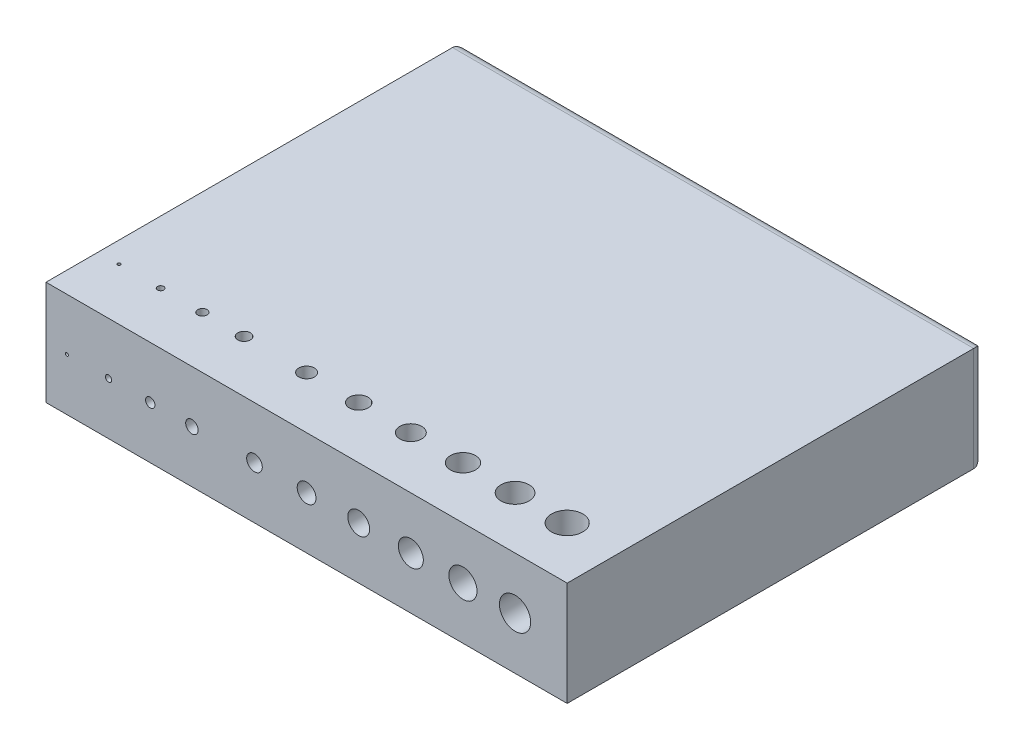
from build123d import *

# Parameters (mm, degrees)
SKETCH1_W                 = 50
SKETCH1_H                 = 40
BOSS_EXTRUDE1_DEPTH       = 10
CUT_EXTRUDE1_START        = -40
CUT_EXTRUDE1_OUTLINE_R    = 0.3
CUT_EXTRUDE1_OUTLINE_R_2  = 0.45
CUT_EXTRUDE1_OUTLINE_R_3  = 0.6
CUT_EXTRUDE1_OUTLINE_R_4  = 0.75
CUT_EXTRUDE1_OUTLINE_R_5  = 0.9
CUT_EXTRUDE1_OUTLINE_R_6  = 1.05
CUT_EXTRUDE1_OUTLINE_R_7  = 1.35
CUT_EXTRUDE1_OUTLINE_R_8  = 1.5
CUT_EXTRUDE1_OUTLINE_R_9  = 1.2
CUT_EXTRUDE1_OUTLINE_R_10 = 0.15
CUT_EXTRUDE1_DEPTH        = 40
FILLET1_R                 = 1


# Read off the part's stored shape, not the designer's step: Cut-Extrude1
with BuildPart() as part:
    # Sketch1 → Boss-Extrude1 (new body)
    with BuildSketch(Plane(origin=(0, 0, 0), x_dir=(1, 0, 0), z_dir=(0, 1, 0))):
        with Locations((0, 20)):
            Rectangle(SKETCH1_W, SKETCH1_H)
    extrude(amount=BOSS_EXTRUDE1_DEPTH)

    # Cut-Extrude1 outline → Cut-Extrude1 (cut)
    with BuildSketch(Plane.XY.offset(CUT_EXTRUDE1_START)):
        with Locations((-19, 5)):
            Circle(CUT_EXTRUDE1_OUTLINE_R)
        with Locations((-15, 5)):
            Circle(CUT_EXTRUDE1_OUTLINE_R_2)
        with Locations((-11, 5)):
            Circle(CUT_EXTRUDE1_OUTLINE_R_3)
        with Locations((-5, 5)):
            Circle(CUT_EXTRUDE1_OUTLINE_R_4)
        with Locations((0, 5)):
            Circle(CUT_EXTRUDE1_OUTLINE_R_5)
        with Locations((5, 5)):
            Circle(CUT_EXTRUDE1_OUTLINE_R_6)
        with Locations((15, 5)):
            Circle(CUT_EXTRUDE1_OUTLINE_R_7)
        with Locations((20, 5)):
            Circle(CUT_EXTRUDE1_OUTLINE_R_8)
        with Locations((10, 5)):
            Circle(CUT_EXTRUDE1_OUTLINE_R_9)
        with Locations((-23, 5)):
            Circle(CUT_EXTRUDE1_OUTLINE_R_10)
    cut_extrude1 = extrude(amount=CUT_EXTRUDE1_DEPTH, mode=Mode.SUBTRACT)

    # Mirror1: Cut-Extrude1 across plane
    add(cut_extrude1.mirror(Plane(origin=(0, 0, 0), x_dir=(0, -0.7071067811865478, 0.7071067811865472), z_dir=(0, 0.7071067811865475, 0.7071067811865477))), mode=Mode.SUBTRACT)

    # Fillet1
    # the kernel refuses this fillet: 1 mm, written as the material it takes off along each edge
    with BuildSketch(Plane(origin=(-27.5, 10, -40), x_dir=(0, -1, 0), z_dir=(1, 0, 0))) as fillet1_piece_1:
        with BuildLine():
            CenterArc((FILLET1_R, -FILLET1_R), FILLET1_R, 90, 90)
            Line((0, -FILLET1_R), (0, 0))
            Line((0, 0), (FILLET1_R, 0))
        make_face()
    extrude(amount=55, mode=Mode.SUBTRACT)
    with BuildSketch(Plane(origin=(-23, 5, -40), x_dir=(1, 0, 0), z_dir=(0, -1, 0))) as fillet1_piece_2:
        with BuildLine():
            CenterArc((0.15 + FILLET1_R, FILLET1_R), FILLET1_R, 180, 90)
            Line((0.15, FILLET1_R), (0.15, 0))
            Line((0.15, 0), (0.15 + FILLET1_R, 0))
        make_face()
    revolve(axis=Axis((-23, 5, -40), (0, 0, 1)), mode=Mode.SUBTRACT)
    with BuildSketch(Plane(origin=(10, 5, -40), x_dir=(1, 0, 0), z_dir=(0, -1, 0))) as fillet1_piece_3:
        with BuildLine():
            CenterArc((1.2 + FILLET1_R, FILLET1_R), FILLET1_R, 180, 90)
            Line((1.2, FILLET1_R), (1.2, 0))
            Line((1.2, 0), (1.2 + FILLET1_R, 0))
        make_face()
    revolve(axis=Axis((10, 5, -40), (0, 0, 1)), mode=Mode.SUBTRACT)
    with BuildSketch(Plane(origin=(20, 5, -40), x_dir=(1, 0, 0), z_dir=(0, -1, 0))) as fillet1_piece_4:
        with BuildLine():
            CenterArc((1.5 + FILLET1_R, FILLET1_R), FILLET1_R, 180, 90)
            Line((1.5, FILLET1_R), (1.5, 0))
            Line((1.5, 0), (1.5 + FILLET1_R, 0))
        make_face()
    revolve(axis=Axis((20, 5, -40), (0, 0, 1)), mode=Mode.SUBTRACT)
    with BuildSketch(Plane(origin=(15, 5, -40), x_dir=(1, 0, 0), z_dir=(0, -1, 0))) as fillet1_piece_5:
        with BuildLine():
            CenterArc((1.35 + FILLET1_R, FILLET1_R), FILLET1_R, 180, 90)
            Line((1.35, FILLET1_R), (1.35, 0))
            Line((1.35, 0), (1.35 + FILLET1_R, 0))
        make_face()
    revolve(axis=Axis((15, 5, -40), (0, 0, 1)), mode=Mode.SUBTRACT)
    with BuildSketch(Plane(origin=(5, 5, -40), x_dir=(1, 0, 0), z_dir=(0, -1, 0))) as fillet1_piece_6:
        with BuildLine():
            CenterArc((1.05 + FILLET1_R, FILLET1_R), FILLET1_R, 180, 90)
            Line((1.05, FILLET1_R), (1.05, 0))
            Line((1.05, 0), (1.05 + FILLET1_R, 0))
        make_face()
    revolve(axis=Axis((5, 5, -40), (0, 0, 1)), mode=Mode.SUBTRACT)
    with BuildSketch(Plane(origin=(0, 5, -40), x_dir=(1, 0, 0), z_dir=(0, -1, 0))) as fillet1_piece_7:
        with BuildLine():
            CenterArc((0.9 + FILLET1_R, FILLET1_R), FILLET1_R, 180, 90)
            Line((0.9, FILLET1_R), (0.9, 0))
            Line((0.9, 0), (0.9 + FILLET1_R, 0))
        make_face()
    revolve(axis=Axis((0, 5, -40), (0, 0, 1)), mode=Mode.SUBTRACT)
    with BuildSketch(Plane(origin=(-5, 5, -40), x_dir=(1, 0, 0), z_dir=(0, -1, 0))) as fillet1_piece_8:
        with BuildLine():
            CenterArc((0.75 + FILLET1_R, FILLET1_R), FILLET1_R, 180, 90)
            Line((0.75, FILLET1_R), (0.75, 0))
            Line((0.75, 0), (0.75 + FILLET1_R, 0))
        make_face()
    revolve(axis=Axis((-5, 5, -40), (0, 0, 1)), mode=Mode.SUBTRACT)
    with BuildSketch(Plane(origin=(-11, 5, -40), x_dir=(1, 0, 0), z_dir=(0, -1, 0))) as fillet1_piece_9:
        with BuildLine():
            CenterArc((0.6 + FILLET1_R, FILLET1_R), FILLET1_R, 180, 90)
            Line((0.6, FILLET1_R), (0.6, 0))
            Line((0.6, 0), (0.6 + FILLET1_R, 0))
        make_face()
    revolve(axis=Axis((-11, 5, -40), (0, 0, 1)), mode=Mode.SUBTRACT)
    with BuildSketch(Plane(origin=(-15, 5, -40), x_dir=(1, 0, 0), z_dir=(0, -1, 0))) as fillet1_piece_10:
        with BuildLine():
            CenterArc((0.45 + FILLET1_R, FILLET1_R), FILLET1_R, 180, 90)
            Line((0.45, FILLET1_R), (0.45, 0))
            Line((0.45, 0), (0.45 + FILLET1_R, 0))
        make_face()
    revolve(axis=Axis((-15, 5, -40), (0, 0, 1)), mode=Mode.SUBTRACT)
    with BuildSketch(Plane(origin=(-19, 5, -40), x_dir=(1, 0, 0), z_dir=(0, -1, 0))) as fillet1_piece_11:
        with BuildLine():
            CenterArc((0.3 + FILLET1_R, FILLET1_R), FILLET1_R, 180, 90)
            Line((0.3, FILLET1_R), (0.3, 0))
            Line((0.3, 0), (0.3 + FILLET1_R, 0))
        make_face()
    revolve(axis=Axis((-19, 5, -40), (0, 0, 1)), mode=Mode.SUBTRACT)
    with BuildSketch(Plane(origin=(-27.5, 0, -40), x_dir=(0, 1, 0), z_dir=(1, 0, 0))) as fillet1_piece_12:
        with BuildLine():
            CenterArc((FILLET1_R, FILLET1_R), FILLET1_R, 180, 90)
            Line((0, FILLET1_R), (0, 0))
            Line((0, 0), (FILLET1_R, 0))
        make_face()
    extrude(amount=55, mode=Mode.SUBTRACT)
    with BuildSketch(Plane(origin=(-25, -2.5, -40), x_dir=(1, 0, 0), z_dir=(0, 1, 0))) as fillet1_piece_13:
        with BuildLine():
            CenterArc((FILLET1_R, -FILLET1_R), FILLET1_R, 90, 90)
            Line((0, -FILLET1_R), (0, 0))
            Line((0, 0), (FILLET1_R, 0))
        make_face()
    extrude(amount=15, mode=Mode.SUBTRACT)
    with BuildSketch(Plane(origin=(25, -2.5, -40), x_dir=(-1, 0, 0), z_dir=(0, 1, 0))) as fillet1_piece_14:
        with BuildLine():
            CenterArc((FILLET1_R, FILLET1_R), FILLET1_R, 180, 90)
            Line((0, FILLET1_R), (0, 0))
            Line((0, 0), (FILLET1_R, 0))
        make_face()
    extrude(amount=15, mode=Mode.SUBTRACT)


solid = part.part
